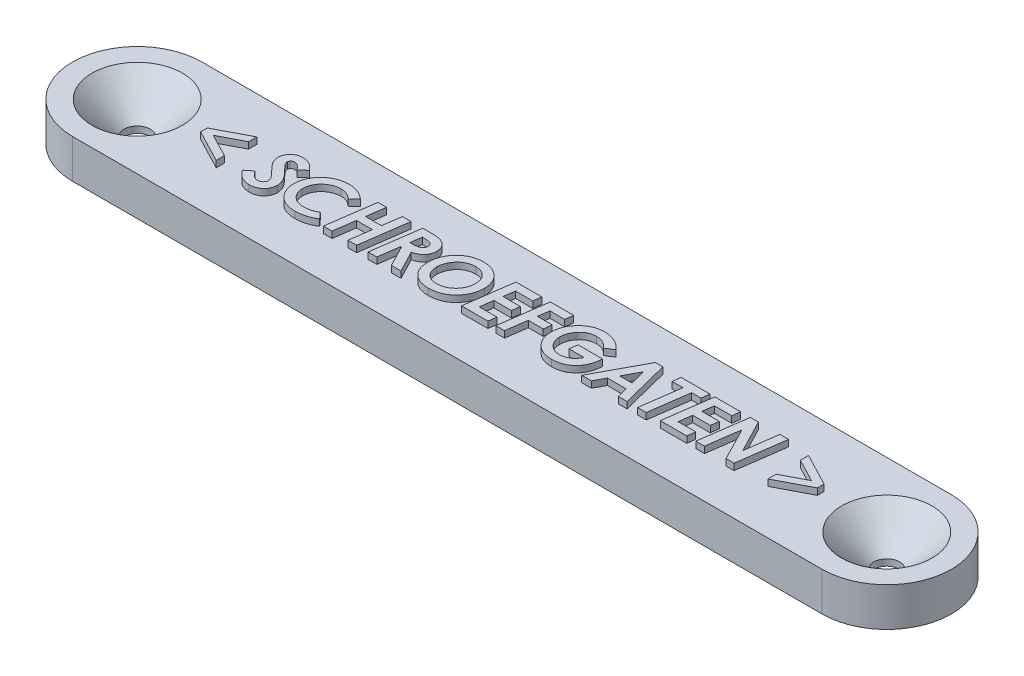
from build123d import *

# Parameters (mm, degrees)
SKETCH1_R           = 1
BOSS_EXTRUDE1_DEPTH = 3
CHAMFER1_SIZE       = 2.5
BOSS_EXTRUDE2_DEPTH = 0.5


with BuildPart() as part:
    # Sketch1 → Boss-Extrude1 (new body)
    with BuildSketch(Plane(origin=(0, 0, 0), x_dir=(1, 0, 0), z_dir=(0, 1, 0))):
        with BuildLine():
            Line((0, 5), (58, 5))
            ThreePointArc((58, 5), (63, 0), (58, -5))
            Line((58, -5), (0, -5))
            ThreePointArc((0, -5), (-5, 0), (0, 5))
        make_face()
        Circle(SKETCH1_R, mode=Mode.SUBTRACT)
        with Locations((58, 0)):
            Circle(SKETCH1_R, mode=Mode.SUBTRACT)
    extrude(amount=BOSS_EXTRUDE1_DEPTH)

    # Chamfer1
    chamfer1_edges = [part.edges().sort_by_distance(p)[0] for p in [
        (57, 3, 0),
        (-1, 3, 0),
    ]]
    chamfer(chamfer1_edges, length=CHAMFER1_SIZE)

    # Sketch2 → Boss-Extrude2 (add)
    # profile 1 of 14: a face of its own
    with BuildSketch(Plane(origin=(0, 3, 0), x_dir=(1, 0, 0), z_dir=(0, 1, 0))):
        Polygon((7.65355235, -0.905865218), (7.65355235, -1.541034822), (5.13661859, -0.230626502), (5.13661859, 0.287303853), (7.65355235, 1.601422276), (7.65355235, 0.96476863), (5.859346621, 0.028338675), align=None)
    # profile 2 of 14: a face of its own
    with BuildSketch(Plane(origin=(0, 3, 0), x_dir=(1, 0, 0), z_dir=(0, 1, 0))):
        with BuildLine():
            Line((11.92536475, 1.389204394), (11.410402477, 0.940281951))
            add(Edge.make_bspline(
                [(11.410402477, 0.940281951), (11.384665885, 0.975048119), (11.335342179, 1.041676839), (11.257075579, 1.131043907), (11.182093303, 1.208702812), (11.106564505, 1.270632453), (11.032945432, 1.319739074), (10.96059455, 1.355310904), (10.88910517, 1.37778951), (10.841418804, 1.380478737), (10.818270065, 1.381784188)],
                knots=[0, 0, 0, 0, 1.358515141, 2.603569235, 3.730126198, 4.746094498, 5.666493297, 6.504166865, 7.273866877, 8, 8, 8, 8], degree=3))
            add(Edge.make_bspline(
                [(10.818270065, 1.381784188), (10.796404105, 1.380837545), (10.754352948, 1.379017024), (10.693991311, 1.363495947), (10.639130466, 1.338529339), (10.592030233, 1.302412061), (10.552692176, 1.260770333), (10.523483135, 1.214040546), (10.506472167, 1.162534021), (10.504114202, 1.126899156), (10.502911325, 1.10872062)],
                knots=[0, 0, 0, 0, 1.130304997, 2.173727141, 3.204821236, 4.229135679, 5.225705988, 6.15679035, 7.05971714, 8, 8, 8, 8], degree=3))
            add(Edge.make_bspline(
                [(10.502911325, 1.10872062), (10.504006811, 1.090812203), (10.50631095, 1.053145396), (10.523192284, 0.996043089), (10.548727533, 0.935877088), (10.57944097, 0.883562673), (10.613925545, 0.836059551), (10.650063219, 0.789578104), (10.697249428, 0.734003819), (10.754667077, 0.668700417), (10.821767628, 0.593116906), (10.90029145, 0.508353037), (10.988824691, 0.413852117), (11.051708052, 0.347853953), (11.084655449, 0.313274573)],
                knots=[0, 0, 0, 0, 0.642317819, 1.35098826, 2.122816345, 2.986294386, 3.520967692, 4.229638134, 5.099348126, 6.137609051, 7.351336444, 8.727500291, 10.285391505, 12, 12, 12, 12], degree=3))
            add(Edge.make_bspline(
                [(11.084655449, 0.313274573), (11.102528567, 0.294785719), (11.136823609, 0.2593092), (11.184944096, 0.207496907), (11.22789262, 0.15947675), (11.267546539, 0.116930566), (11.301492831, 0.07766156), (11.330476559, 0.042611855), (11.355081995, 0.012274649), (11.369628986, -0.006754113), (11.376269531, -0.015440538)],
                knots=[0, 0, 0, 0, 1.403722598, 2.693470914, 3.859630393, 4.920438112, 5.867965235, 6.69256451, 7.40316977, 8, 8, 8, 8], degree=3))
            add(Edge.make_bspline(
                [(11.376269531, -0.015440538), (11.402712591, -0.051971948), (11.453713369, -0.122430146), (11.519865167, -0.229556613), (11.574580087, -0.332770912), (11.617574998, -0.433294573), (11.649738034, -0.532227081), (11.673032762, -0.63120379), (11.68770659, -0.731047986), (11.689334076, -0.798223522), (11.690144231, -0.831663161)],
                knots=[0, 0, 0, 0, 1.215130546, 2.343624586, 3.390252636, 4.360992906, 5.286454858, 6.190345157, 7.099163061, 8, 8, 8, 8], degree=3))
            add(Edge.make_bspline(
                [(11.690144231, -0.831663161), (11.689136088, -0.868571129), (11.687152057, -0.941206196), (11.671778255, -1.047775487), (11.647832372, -1.149958349), (11.612125428, -1.247140884), (11.568036068, -1.340380607), (11.512077301, -1.428312179), (11.447703937, -1.512423398), (11.373388583, -1.59072717), (11.292049236, -1.662335613), (11.203479681, -1.724346137), (11.109861737, -1.777201889), (11.010243727, -1.820716373), (10.904929213, -1.853812707), (10.794106073, -1.877353042), (10.677978887, -1.892979033), (10.59843723, -1.894302718), (10.557820847, -1.894978632)],
                knots=[0, 0, 0, 0, 1.018989505, 2.005376454, 2.968035412, 3.912365187, 4.859556873, 5.811049809, 6.78527381, 7.780773345, 8.787785161, 9.773320145, 10.761314359, 11.752515283, 12.770107012, 13.804505292, 14.878913802, 16, 16, 16, 16], degree=3))
            add(Edge.make_bspline(
                [(10.557820847, -1.894978632), (10.526639512, -1.894353853), (10.464913163, -1.893117044), (10.373423415, -1.884905249), (10.284151966, -1.870886646), (10.197230006, -1.850656762), (10.112476038, -1.825396877), (10.02975793, -1.795076717), (9.949282655, -1.758377698), (9.870947151, -1.716254104), (9.794744177, -1.668541191), (9.721130979, -1.614669838), (9.64931332, -1.555678904), (9.580232499, -1.490451148), (9.512429976, -1.420787083), (9.447093302, -1.345101931), (9.384878995, -1.263078476), (9.345385277, -1.205797993), (9.325324686, -1.176702724)],
                knots=[0, 0, 0, 0, 1.003438088, 1.986398949, 2.953471805, 3.909242729, 4.856156023, 5.798037682, 6.742035895, 7.700024963, 8.658509928, 9.632892881, 10.633707184, 11.647385023, 12.688779161, 13.761077638, 14.862753205, 16, 16, 16, 16], degree=3))
            Line((9.325324686, -1.176702724), (9.873677885, -0.745588775))
            add(Edge.make_bspline(
                [(9.873677885, -0.745588775), (9.900990545, -0.787585501), (9.95337449, -0.868132549), (10.038757904, -0.976856793), (10.125805939, -1.069260272), (10.214834662, -1.14498371), (10.306130499, -1.203902372), (10.399038097, -1.246017905), (10.493970943, -1.27310655), (10.558389263, -1.276117874), (10.590469752, -1.277617521)],
                knots=[0, 0, 0, 0, 1.289844872, 2.473840458, 3.555310637, 4.554525788, 5.477014656, 6.343795492, 7.175205895, 8, 8, 8, 8], degree=3))
            add(Edge.make_bspline(
                [(10.590469752, -1.277617521), (10.620069533, -1.276320302), (10.677691107, -1.273795019), (10.7601185, -1.250282891), (10.835742509, -1.214037424), (10.90121318, -1.162284591), (10.956367633, -1.101504345), (10.996459994, -1.03226263), (11.020596577, -0.956396341), (11.023704547, -0.903814221), (11.025293803, -0.876926416)],
                knots=[0, 0, 0, 0, 1.07813582, 2.098795369, 3.104167493, 4.120866408, 5.124778177, 6.083335831, 7.019916046, 8, 8, 8, 8], degree=3))
            add(Edge.make_bspline(
                [(11.025293803, -0.876926416), (11.024534576, -0.855071999), (11.022990169, -0.810616088), (11.006891192, -0.744403876), (10.982997647, -0.677264993), (10.95403797, -0.62052249), (10.92280308, -0.57076678), (10.889725024, -0.525709461), (10.848103345, -0.472822708), (10.796611476, -0.413347872), (10.737354257, -0.345277082), (10.668086426, -0.27100266), (10.591021126, -0.188066649), (10.535687563, -0.131322189), (10.506621428, -0.101514924)],
                knots=[0, 0, 0, 0, 0.82235112, 1.672813781, 2.554588539, 3.50524042, 4.06657461, 4.767804758, 5.610876414, 6.602916144, 7.732569792, 9.01260869, 10.430754915, 12, 12, 12, 12], degree=3))
            add(Edge.make_bspline(
                [(10.506621428, -0.101514924), (10.47585787, -0.069697232), (10.416386995, -0.008188547), (10.332251633, 0.081829005), (10.256465671, 0.165612464), (10.189114919, 0.243249991), (10.130143746, 0.314881148), (10.078531744, 0.379962524), (10.035841053, 0.439352639), (10.011763768, 0.477886362), (10.000563401, 0.495811632)],
                knots=[0, 0, 0, 0, 1.354401886, 2.618275412, 3.770529779, 4.811580489, 5.763301005, 6.60974666, 7.35327647, 8, 8, 8, 8], degree=3))
            add(Edge.make_bspline(
                [(10.000563401, 0.495811632), (9.975555117, 0.540478683), (9.927034728, 0.627140473), (9.877013805, 0.763538023), (9.844417132, 0.898183223), (9.840155938, 0.98808955), (9.838060897, 1.032292501)],
                knots=[0, 0, 0, 0, 1.081804801, 2.098888081, 3.065307629, 4, 4, 4, 4], degree=3))
            add(Edge.make_bspline(
                [(9.838060897, 1.032292501), (9.838813157, 1.060770824), (9.840309541, 1.117419528), (9.851082355, 1.201025562), (9.867577192, 1.282779467), (9.893872683, 1.36144118), (9.924198968, 1.438980393), (9.963839188, 1.513359684), (10.008375121, 1.586580095), (10.044104925, 1.631938447), (10.062151108, 1.654847756)],
                knots=[0, 0, 0, 0, 1.012167245, 2.013389743, 2.992947912, 3.971795425, 4.958040075, 5.949133471, 6.964161297, 8, 8, 8, 8], degree=3))
            add(Edge.make_bspline(
                [(10.062151108, 1.654847756), (10.085973634, 1.682457888), (10.132960239, 1.736915019), (10.214255986, 1.80652671), (10.300452082, 1.866655373), (10.393403947, 1.914926571), (10.492042712, 1.953399276), (10.597306504, 1.979505584), (10.708388598, 1.996560724), (10.784566047, 1.998271654), (10.823464209, 1.999145299)],
                knots=[0, 0, 0, 0, 1.010152455, 1.992384693, 2.959065588, 3.919519142, 4.890305168, 5.888624478, 6.921877408, 8, 8, 8, 8], degree=3))
            add(Edge.make_bspline(
                [(10.823464209, 1.999145299), (10.877254415, 1.997267403), (10.983363466, 1.993562979), (11.139465627, 1.964770446), (11.288221877, 1.915964641), (11.431119952, 1.849654032), (11.565839644, 1.762326793), (11.694180181, 1.656764256), (11.81607074, 1.532213997), (11.888254643, 1.437762423), (11.92536475, 1.389204394)],
                knots=[0, 0, 0, 0, 0.984438778, 1.941949542, 2.894274057, 3.844399604, 4.817935388, 5.825099055, 6.88187249, 8, 8, 8, 8], degree=3))
        make_face()
    # profile 3 of 14: a face of its own
    with BuildSketch(Plane(origin=(0, 3, 0), x_dir=(1, 0, 0), z_dir=(0, 1, 0))):
        with BuildLine():
            Line((15.829134949, 1.438177751), (15.316398738, 0.978867021))
            add(Edge.make_bspline(
                [(15.316398738, 0.978867021), (15.287944764, 1.010043092), (15.231148684, 1.072272664), (15.132737331, 1.152185225), (15.02611187, 1.221741135), (14.910788409, 1.279487454), (14.788512726, 1.325609251), (14.660334387, 1.35810817), (14.527014325, 1.377949124), (14.436431448, 1.380491185), (14.390357071, 1.381784188)],
                knots=[0, 0, 0, 0, 0.971056601, 1.938295404, 2.910103745, 3.898650509, 4.902833105, 5.914277838, 6.939111328, 8, 8, 8, 8], degree=3))
            add(Edge.make_bspline(
                [(14.390357071, 1.381784188), (14.357684615, 1.381272235), (14.292689091, 1.380253804), (14.195736395, 1.370236986), (14.099884035, 1.353777375), (14.004975928, 1.33150034), (13.910783324, 1.303472759), (13.818335468, 1.267528367), (13.726770855, 1.22572358), (13.636517563, 1.17871277), (13.549784485, 1.1255076), (13.467226333, 1.06835892), (13.389634025, 1.007456469), (13.317402828, 0.941816591), (13.250078502, 0.871893606), (13.186439825, 0.798774187), (13.12966264, 0.720189509), (13.076775516, 0.639051417), (13.030298021, 0.554540509), (12.989679797, 0.468467289), (12.953817287, 0.381445857), (12.92736246, 0.292117511), (12.9041292, 0.201998772), (12.889232883, 0.110089943), (12.878827837, 0.016953038), (12.877862472, -0.045586599), (12.877377137, -0.077028245)],
                knots=[0, 0, 0, 0, 1.01063672, 2.010466049, 3.011934156, 4.018040672, 5.025194429, 6.049901815, 7.084166442, 8.138480354, 9.196343408, 10.230183256, 11.243713301, 12.245999792, 13.247233952, 14.245803109, 15.242258641, 16.244194478, 17.240973215, 18.223430354, 19.188354289, 20.149355445, 21.103383867, 22.065846529, 23.027609163, 24, 24, 24, 24], degree=3))
            add(Edge.make_bspline(
                [(12.877377137, -0.077028245), (12.878195301, -0.119143153), (12.879805042, -0.202004316), (12.897870387, -0.323398575), (12.924758704, -0.439639253), (12.963675838, -0.550339178), (13.013865938, -0.655255128), (13.073831292, -0.75562748), (13.146797276, -0.849043884), (13.228524504, -0.937228238), (13.319478886, -1.016745395), (13.416952536, -1.087336773), (13.52156616, -1.145813144), (13.631928549, -1.19468018), (13.749029565, -1.231483151), (13.871966327, -1.258048366), (14.001065774, -1.275016288), (14.089290034, -1.276737983), (14.134359976, -1.277617521)],
                knots=[0, 0, 0, 0, 1.037508871, 2.041300697, 3.018951676, 3.975513831, 4.927438979, 5.88223082, 6.851861871, 7.844178858, 8.842305637, 9.825493826, 10.805727671, 11.791408773, 12.796144752, 13.825955475, 14.88937509, 16, 16, 16, 16], degree=3))
            add(Edge.make_bspline(
                [(14.134359976, -1.277617521), (14.182869805, -1.276789753), (14.27834663, -1.275160543), (14.418919719, -1.261480807), (14.554534235, -1.239271468), (14.685092768, -1.208388655), (14.810725676, -1.167808836), (14.931464251, -1.119179358), (15.047451826, -1.061177656), (15.120354868, -1.015537811), (15.156864316, -0.992681624)],
                knots=[0, 0, 0, 0, 1.080949117, 2.127519159, 3.144326023, 4.141762213, 5.114520833, 6.083915527, 7.040435296, 8, 8, 8, 8], degree=3))
            Line((15.156864316, -0.992681624), (15.573137854, -1.451250334))
            add(Edge.make_bspline(
                [(15.573137854, -1.451250334), (15.520005097, -1.486751513), (15.414030786, -1.5575593), (15.24589681, -1.64786699), (15.071458093, -1.723673512), (14.89135233, -1.786120454), (14.705154197, -1.835482035), (14.512590028, -1.869975418), (14.313677669, -1.891455454), (14.178936344, -1.893793247), (14.110615318, -1.894978632)],
                knots=[0, 0, 0, 0, 0.987115275, 1.968820479, 2.944554184, 3.923725951, 4.912076401, 5.918257257, 6.944445583, 8, 8, 8, 8], degree=3))
            add(Edge.make_bspline(
                [(14.110615318, -1.894978632), (14.062858571, -1.89424045), (13.968962477, -1.892789087), (13.831013186, -1.882136586), (13.698383294, -1.865468257), (13.571328102, -1.840777042), (13.449599601, -1.809796701), (13.333169069, -1.772032059), (13.222496854, -1.726502309), (13.116916125, -1.674799115), (13.016990188, -1.615582138), (12.92180101, -1.550431893), (12.832060739, -1.478177643), (12.747014389, -1.400100513), (12.667447816, -1.315238283), (12.593158129, -1.223497509), (12.523489431, -1.125628734), (12.459120856, -1.02214146), (12.401325007, -0.914077443), (12.351243605, -0.802859415), (12.30737676, -0.690001037), (12.273816785, -0.574050863), (12.245882088, -0.456542615), (12.226926139, -0.336224642), (12.214442034, -0.214073249), (12.213166812, -0.131721447), (12.212526709, -0.090384615)],
                knots=[0, 0, 0, 0, 1.169367826, 2.299132101, 3.38621766, 4.441052208, 5.466435492, 6.460518735, 7.435693363, 8.394593391, 9.33676259, 10.277587488, 11.216890426, 12.155626877, 13.10261201, 14.062754619, 15.044266364, 16.042621295, 17.045211417, 18.042739217, 19.028130471, 20.007415779, 20.996189116, 21.983978755, 22.988049715, 24, 24, 24, 24], degree=3))
            add(Edge.make_bspline(
                [(12.212526709, -0.090384615), (12.213304775, -0.045823003), (12.214856203, 0.043030823), (12.229818041, 0.17562325), (12.252452335, 0.306819915), (12.284854114, 0.436615045), (12.325218912, 0.565057447), (12.376503636, 0.691601182), (12.435575802, 0.817319298), (12.504708489, 0.94032363), (12.580156068, 1.06008643), (12.663895405, 1.173319652), (12.753878353, 1.280113295), (12.849304433, 1.381472327), (12.952250724, 1.475147426), (13.061767571, 1.562115474), (13.177449764, 1.642979921), (13.299117426, 1.717087968), (13.425067516, 1.783702915), (13.554983099, 1.840810679), (13.687358344, 1.890224791), (13.822727919, 1.930191825), (13.961169709, 1.960581695), (14.102120175, 1.982885246), (14.246132819, 1.996601689), (14.343085483, 1.998294179), (14.391841112, 1.999145299)],
                knots=[0, 0, 0, 0, 0.95794203, 1.910092795, 2.865876462, 3.819215003, 4.78477586, 5.758651491, 6.753180615, 7.769892659, 8.790977917, 9.795230985, 10.79565955, 11.792688852, 12.786634645, 13.785945562, 14.798181656, 15.819862441, 16.847685968, 17.859754353, 18.869513914, 19.884373831, 20.892254455, 21.915374149, 22.951681752, 24, 24, 24, 24], degree=3))
            add(Edge.make_bspline(
                [(14.391841112, 1.999145299), (14.459941593, 1.99741256), (14.59441842, 1.993990949), (14.792468982, 1.967479879), (14.98360689, 1.923781582), (15.16757276, 1.861658078), (15.345042714, 1.783005084), (15.514840349, 1.685771317), (15.677681934, 1.571261831), (15.778218604, 1.482918722), (15.829134949, 1.438177751)],
                knots=[0, 0, 0, 0, 1.033545388, 2.040923972, 3.027343848, 4.005734438, 4.983995331, 5.969464303, 6.971644303, 8, 8, 8, 8], degree=3))
        make_face()
    # profile 4 of 14: a face of its own
    with BuildSketch(Plane(origin=(0, 3, 0), x_dir=(1, 0, 0), z_dir=(0, 1, 0))):
        Polygon((16.72104367, 1.904166667), (17.391830262, 1.904166667), (17.192226729, 0.479487179), (18.421754808, 0.479487179), (18.620616319, 1.904166667), (19.291402911, 1.904166667), (18.771988515, -1.8), (18.101201923, -1.8), (18.334196381, -0.137873932), (17.105410323, -0.137873932), (16.872415865, -1.8), (16.201629274, -1.8), align=None)
    # profile 5 of 14: a face of its own
    with BuildSketch(Plane(origin=(0, 3, 0), x_dir=(1, 0, 0), z_dir=(0, 1, 0))):
        with BuildLine():
            Line((20.187763755, 1.904166667), (20.831095586, 1.904166667))
            add(Edge.make_bspline(
                [(20.831095586, 1.904166667), (20.878837763, 1.903971565), (20.970890419, 1.903595386), (21.103265133, 1.898246117), (21.2247626, 1.89017572), (21.335238355, 1.879525232), (21.434784634, 1.864748276), (21.523194423, 1.84700558), (21.601032417, 1.827246616), (21.647711587, 1.808885297), (21.669578826, 1.800283787)],
                knots=[0, 0, 0, 0, 1.348808202, 2.600664361, 3.742342956, 4.788858012, 5.735658768, 6.584006912, 7.336666444, 8, 8, 8, 8], degree=3))
            add(Edge.make_bspline(
                [(21.669578826, 1.800283787), (21.694198526, 1.789181479), (21.742326142, 1.767478223), (21.811290211, 1.730689872), (21.875869694, 1.691058834), (21.934994302, 1.647090889), (21.989911746, 1.600637385), (22.04028149, 1.551256489), (22.085697951, 1.498190355), (22.126637766, 1.442390796), (22.163041272, 1.38392998), (22.194289932, 1.32251962), (22.221310107, 1.258679634), (22.242410624, 1.19171533), (22.25994769, 1.122430539), (22.271290028, 1.050388121), (22.27927223, 0.975831089), (22.279928123, 0.925216609), (22.280261752, 0.89947082)],
                knots=[0, 0, 0, 0, 1.116361014, 2.182309107, 3.229450697, 4.24598407, 5.225421932, 6.201651319, 7.158895679, 8.110002388, 9.060669178, 10.002827475, 10.956240434, 11.923213192, 12.902917952, 13.908279153, 14.936015885, 16, 16, 16, 16], degree=3))
            add(Edge.make_bspline(
                [(22.280261752, 0.89947082), (22.27947714, 0.867788855), (22.277928188, 0.805243527), (22.267807013, 0.713012028), (22.248929763, 0.624506329), (22.223507801, 0.539447629), (22.192012031, 0.457285183), (22.151394115, 0.379448679), (22.104444856, 0.304581912), (22.050223252, 0.233666431), (21.989617555, 0.166051704), (21.919639209, 0.105716933), (21.844159514, 0.048604433), (21.76007766, -0.001456654), (21.669706103, -0.047958946), (21.570983598, -0.087358515), (21.46576301, -0.123718235), (21.391984253, -0.141915768), (21.354220085, -0.151230302)],
                knots=[0, 0, 0, 0, 0.995453645, 1.965186658, 2.910129054, 3.83459069, 4.752398018, 5.669942118, 6.588407184, 7.525617038, 8.471772905, 9.435289717, 10.423772802, 11.441988612, 12.505459691, 13.613754905, 14.778583949, 16, 16, 16, 16], degree=3))
            Line((21.354220085, -0.151230302), (22.209027778, -1.8))
            Line((22.209027778, -1.8), (21.466265191, -1.8))
            Line((21.466265191, -1.8), (20.629265992, -0.185363248))
            Line((20.629265992, -0.185363248), (20.566194244, -0.185363248))
            Line((20.566194244, -0.185363248), (20.339135951, -1.8))
            Line((20.339135951, -1.8), (19.668349359, -1.8))
            Line((19.668349359, -1.8), (20.187763755, 1.904166667))
        make_face()
        with BuildLine():
            add(Edge.make_bspline(
                [(20.65301065, 0.431997863), (20.700754262, 0.432441188), (20.79207578, 0.433289158), (20.922500959, 0.4391874), (21.040114383, 0.44850448), (21.144576852, 0.461819195), (21.236163158, 0.477565686), (21.314484241, 0.497224054), (21.379899086, 0.520597497), (21.433439454, 0.548316066), (21.476810839, 0.580860369), (21.514350636, 0.615590242), (21.545609271, 0.65446649), (21.571400446, 0.696836462), (21.59129233, 0.742787979), (21.605637453, 0.792632354), (21.613568986, 0.846037247), (21.614788289, 0.882874105), (21.615411325, 0.901696882)],
                knots=[0, 0, 0, 0, 1.892208387, 3.619318591, 5.173427176, 6.566868293, 7.791773198, 8.8545744, 9.763297566, 10.539470204, 11.233547833, 11.906251103, 12.5615143, 13.203742025, 13.866659999, 14.539934446, 15.25394049, 16, 16, 16, 16], degree=3))
            add(Edge.make_bspline(
                [(21.615411325, 0.901696882), (21.614604829, 0.923039193), (21.613040339, 0.96444035), (21.599508136, 1.024069956), (21.576368534, 1.078162107), (21.543848978, 1.126199659), (21.50326632, 1.168556794), (21.453757701, 1.203442781), (21.395888841, 1.230904765), (21.341679523, 1.249048065), (21.290367562, 1.259557129), (21.242534927, 1.266617813), (21.185902424, 1.273431121), (21.120299704, 1.278469347), (21.045805631, 1.28180204), (20.962458132, 1.285040468), (20.870425351, 1.286192071), (20.806114061, 1.286594871), (20.772475962, 1.286805556)],
                knots=[0, 0, 0, 0, 0.974340854, 1.890087692, 2.776057671, 3.647490651, 4.526730822, 5.442477659, 6.397820337, 7.445016909, 8.045730266, 8.789007992, 9.653967296, 10.651691253, 11.794598421, 13.061237498, 14.462876682, 16, 16, 16, 16], degree=3))
            Line((20.772475962, 1.286805556), (20.65301065, 0.431997863))
        make_face(mode=Mode.SUBTRACT)
    # profile 6 of 14: a face of its own
    with BuildSketch(Plane(origin=(0, 3, 0), x_dir=(1, 0, 0), z_dir=(0, 1, 0))):
        with BuildLine():
            add(Edge.make_bspline(
                [(24.840974726, 1.999145299), (24.903379166, 1.99783561), (25.025908427, 1.995264074), (25.20551016, 1.971599716), (25.376853801, 1.933457662), (25.539521877, 1.878762863), (25.694138955, 1.809665616), (25.840332983, 1.724512075), (25.977944328, 1.623903248), (26.105852513, 1.509202352), (26.221712978, 1.38282257), (26.324456828, 1.247556763), (26.409784483, 1.102789662), (26.480054145, 0.950133294), (26.535447351, 0.789420741), (26.573233484, 0.619879694), (26.598175332, 0.442633545), (26.60057002, 0.321524598), (26.60178953, 0.259849092)],
                knots=[0, 0, 0, 0, 1.079937363, 2.120424901, 3.130164457, 4.114608815, 5.086352068, 6.057283592, 7.037967613, 8.032612779, 9.026667848, 10.002130715, 10.967845321, 11.92966918, 12.907375778, 13.904589319, 14.932898699, 16, 16, 16, 16], degree=3))
            add(Edge.make_bspline(
                [(26.60178953, 0.259849092), (26.601008513, 0.211829104), (26.599455131, 0.11632107), (26.584673966, -0.025689715), (26.56164691, -0.165685149), (26.530117391, -0.303705639), (26.487911999, -0.439308508), (26.437532265, -0.57329719), (26.377431133, -0.705123482), (26.30840822, -0.833766312), (26.2327952, -0.957710373), (26.149918704, -1.074908673), (26.060884103, -1.184665661), (25.966033103, -1.287413441), (25.864341502, -1.381776489), (25.757796905, -1.469731634), (25.644091212, -1.549279635), (25.525029499, -1.621940183), (25.40036293, -1.686516046), (25.270933905, -1.742329491), (25.136910876, -1.78899463), (24.998610297, -1.827574508), (24.855690573, -1.858267091), (24.708178165, -1.879469526), (24.556021328, -1.892337061), (24.4531707, -1.89408915), (24.40095653, -1.894978632)],
                knots=[0, 0, 0, 0, 1.005311864, 1.999487392, 2.986390894, 3.975195422, 4.961487101, 5.958115224, 6.97104375, 7.992937587, 9.013623077, 10.009524137, 10.996414046, 11.971324635, 12.935123389, 13.899409138, 14.862205298, 15.838449601, 16.81836937, 17.799766407, 18.787539403, 19.787875373, 20.804768927, 21.846385261, 22.906674593, 24, 24, 24, 24], degree=3))
            add(Edge.make_bspline(
                [(24.40095653, -1.894978632), (24.336329903, -1.893646804), (24.21013892, -1.891046255), (24.026224195, -1.8680783), (23.852213744, -1.8322174), (23.688099547, -1.78087983), (23.533575873, -1.714680877), (23.389152656, -1.633452202), (23.254476271, -1.538079436), (23.131804394, -1.427886564), (23.020258143, -1.307015322), (22.924472343, -1.174460661), (22.841755658, -1.033801189), (22.776131761, -0.882732112), (22.723621006, -0.723107257), (22.68703601, -0.554008383), (22.664157263, -0.375701577), (22.661523437, -0.253700669), (22.660176282, -0.191299412)],
                knots=[0, 0, 0, 0, 1.129126937, 2.20475128, 3.23403939, 4.230775744, 5.204839333, 6.16680792, 7.121629951, 8.083044708, 9.04383724, 9.990659777, 10.936010704, 11.890255174, 12.863608629, 13.868449271, 14.909750384, 16, 16, 16, 16], degree=3))
            add(Edge.make_bspline(
                [(22.660176282, -0.191299412), (22.661794793, -0.119971845), (22.664981727, 0.020475947), (22.692996639, 0.22721353), (22.735818185, 0.426771216), (22.798913702, 0.618088672), (22.878485915, 0.801891871), (22.976493285, 0.977568843), (23.091417239, 1.14654413), (23.181015195, 1.250529441), (23.226337974, 1.303130008)],
                knots=[0, 0, 0, 0, 1.045740506, 2.05911896, 3.05467723, 4.035585325, 5.008815224, 5.988058098, 6.982266978, 8, 8, 8, 8], degree=3))
            add(Edge.make_bspline(
                [(23.226337974, 1.303130008), (23.252721762, 1.331649666), (23.305014305, 1.388175493), (23.388705276, 1.466728325), (23.474444941, 1.540272881), (23.563446927, 1.607936093), (23.654367042, 1.671289494), (23.748654098, 1.728336338), (23.845951431, 1.779695653), (23.945200838, 1.826528663), (24.048110022, 1.866516912), (24.152900143, 1.902346406), (24.261025441, 1.931909085), (24.371723863, 1.956377507), (24.485101376, 1.975833117), (24.601308614, 1.988890291), (24.720147879, 1.997340056), (24.800396423, 1.998539029), (24.840974726, 1.999145299)],
                knots=[0, 0, 0, 0, 1.027812829, 2.037120149, 3.035266778, 4.015768311, 4.994345575, 5.966422343, 6.929711672, 7.904780536, 8.86860337, 9.849672715, 10.834163809, 11.833018336, 12.848777673, 13.876590502, 14.926281379, 16, 16, 16, 16], degree=3))
        make_face()
        with BuildLine():
            add(Edge.make_bspline(
                [(24.825392294, 1.381784188), (24.791729873, 1.381280941), (24.724758752, 1.380279735), (24.625633644, 1.370211134), (24.528502689, 1.354610689), (24.433773998, 1.333231179), (24.340993089, 1.305638605), (24.250791644, 1.271539428), (24.162503219, 1.231184378), (24.077101183, 1.184618919), (23.994299043, 1.132691958), (23.915825828, 1.074740632), (23.841129727, 1.011594535), (23.771468006, 0.942140359), (23.705310936, 0.867805204), (23.642843712, 0.788438926), (23.584846527, 0.703268528), (23.531061422, 0.613710727), (23.483317384, 0.520500018), (23.440910061, 0.426504143), (23.404818679, 0.331709721), (23.376196072, 0.23585901), (23.352830489, 0.139336256), (23.336628602, 0.041887148), (23.326568854, -0.056284237), (23.325541301, -0.122020252), (23.325026709, -0.154940405)],
                knots=[0, 0, 0, 0, 1.015557909, 2.02044445, 3.003357477, 3.982977463, 4.948851735, 5.922052592, 6.890662853, 7.875953625, 8.855459861, 9.837777552, 10.817397539, 11.804383193, 12.803598646, 13.818964529, 14.849984807, 15.911175445, 16.969421976, 18.008462528, 19.021851172, 20.027762868, 21.025304218, 22.016795393, 23.006824523, 24, 24, 24, 24], degree=3))
            add(Edge.make_bspline(
                [(23.325026709, -0.154940405), (23.325839108, -0.193321537), (23.327437548, -0.268838516), (23.34136608, -0.380004132), (23.362946986, -0.487029897), (23.395603582, -0.589028789), (23.435284257, -0.687103641), (23.485665132, -0.779788652), (23.543580511, -0.868916506), (23.610892623, -0.952223241), (23.68607647, -1.029137701), (23.770896879, -1.095494991), (23.863195624, -1.152156063), (23.963369116, -1.198263138), (24.071334818, -1.234249613), (24.187370368, -1.258703179), (24.310965181, -1.274907551), (24.395955606, -1.276698871), (24.4395416, -1.277617521)],
                knots=[0, 0, 0, 0, 1.032572517, 2.031642993, 3.01079972, 3.966643664, 4.909863955, 5.853952978, 6.801111379, 7.766917104, 8.731873648, 9.689385086, 10.65752794, 11.640388645, 12.650815691, 13.713650281, 14.827481725, 16, 16, 16, 16], degree=3))
            add(Edge.make_bspline(
                [(24.4395416, -1.277617521), (24.490562849, -1.276412032), (24.591309674, -1.274031665), (24.739289095, -1.252830476), (24.881342587, -1.217635669), (25.017482345, -1.169541523), (25.147752225, -1.107293177), (25.272155458, -1.031320364), (25.390371056, -0.940898348), (25.501448058, -0.838392269), (25.603485575, -0.726509743), (25.692680126, -0.606936912), (25.76842763, -0.481248038), (25.830141444, -0.349717967), (25.877891534, -0.212125307), (25.911930858, -0.068711802), (25.933411675, 0.080618893), (25.935753319, 0.182358515), (25.936939103, 0.233878372)],
                knots=[0, 0, 0, 0, 1.03369803, 2.041145535, 3.022357397, 3.995919545, 4.96236968, 5.943376615, 6.945032455, 7.973917545, 9.003120129, 10.009769043, 10.992465341, 11.972511115, 12.949140339, 13.93890809, 14.956285095, 16, 16, 16, 16], degree=3))
            add(Edge.make_bspline(
                [(25.936939103, 0.233878372), (25.936255026, 0.276222576), (25.934914389, 0.359207661), (25.919434939, 0.480047349), (25.895921111, 0.594582544), (25.862866903, 0.702777846), (25.818345415, 0.804024562), (25.766113969, 0.899569026), (25.70285767, 0.987790299), (25.631174351, 1.068980063), (25.551922417, 1.142752703), (25.465477546, 1.206360078), (25.373719472, 1.261586488), (25.27507886, 1.304671611), (25.171340599, 1.340407979), (25.061281952, 1.364433737), (24.945230649, 1.378622147), (24.865997159, 1.380712793), (24.825392294, 1.381784188)],
                knots=[0, 0, 0, 0, 1.12845219, 2.211511647, 3.242392028, 4.243671568, 5.221368115, 6.186708094, 7.141970352, 8.109200861, 9.070590294, 10.022934043, 10.966237583, 11.91979086, 12.887493425, 13.887534174, 14.917422563, 16, 16, 16, 16], degree=3))
        make_face(mode=Mode.SUBTRACT)
    # profile 7 of 14: a face of its own
    with BuildSketch(Plane(origin=(0, 3, 0), x_dir=(1, 0, 0), z_dir=(0, 1, 0))):
        Polygon((27.406139824, 1.904166667), (29.403659188, 1.904166667), (29.325747029, 1.286805556), (27.99085203, 1.286805556), (27.870644698, 0.431997863), (29.218154046, 0.431997863), (29.139499866, -0.185363248), (27.783828292, -0.185363248), (27.644328425, -1.182638889), (29.014098391, -1.182638889), (28.936186231, -1.8), (26.886725427, -1.8), align=None)
    # profile 8 of 14: a face of its own
    with BuildSketch(Plane(origin=(0, 3, 0), x_dir=(1, 0, 0), z_dir=(0, 1, 0))):
        Polygon((30.065541533, 1.904166667), (31.873103632, 1.904166667), (31.792223391, 1.286805556), (30.650253739, 1.286805556), (30.530046408, 0.431997863), (31.680920306, 0.431997863), (31.600040064, -0.185363248), (30.443972022, -0.185363248), (30.216913729, -1.8), (29.546127137, -1.8), align=None)
    # profile 9 of 14: a face of its own
    with BuildSketch(Plane(origin=(0, 3, 0), x_dir=(1, 0, 0), z_dir=(0, 1, 0))):
        with BuildLine():
            Line((35.799876469, 1.228927951), (35.209970119, 0.859401709))
            add(Edge.make_bspline(
                [(35.209970119, 0.859401709), (35.168131131, 0.905104079), (35.088203451, 0.992412223), (34.962836556, 1.106566246), (34.839340063, 1.198498569), (34.715801169, 1.268485424), (34.58940839, 1.320459141), (34.456630792, 1.355426873), (34.316086252, 1.377663909), (34.219706278, 1.380389701), (34.170399306, 1.381784188)],
                knots=[0, 0, 0, 0, 1.232977487, 2.355435308, 3.369770187, 4.291348691, 5.174604885, 6.082334442, 7.018942652, 8, 8, 8, 8], degree=3))
            add(Edge.make_bspline(
                [(34.170399306, 1.381784188), (34.116862232, 1.380365132), (34.011642857, 1.377576181), (33.85818019, 1.351184454), (33.71195929, 1.310820374), (33.573605805, 1.25235551), (33.443036135, 1.176704507), (33.320093616, 1.084806845), (33.204692285, 0.976573388), (33.136629326, 0.8940843), (33.10188969, 0.851981504)],
                knots=[0, 0, 0, 0, 1.037106879, 2.038283569, 3.009830787, 3.972569298, 4.94146214, 5.928319872, 6.942605276, 8, 8, 8, 8], degree=3))
            add(Edge.make_bspline(
                [(33.10188969, 0.851981504), (33.075792969, 0.816786349), (33.024240137, 0.747259996), (32.958434987, 0.636612597), (32.901730577, 0.523937421), (32.855245975, 0.408106898), (32.81967801, 0.289347903), (32.794557485, 0.167426399), (32.778319518, 0.042874623), (32.776377091, -0.041361338), (32.775400641, -0.08370643)],
                knots=[0, 0, 0, 0, 1.040960542, 2.056368018, 3.055559505, 4.03710588, 5.019268411, 5.998275661, 6.99374091, 8, 8, 8, 8], degree=3))
            add(Edge.make_bspline(
                [(32.775400641, -0.08370643), (32.776399824, -0.125055001), (32.778369597, -0.206568965), (32.793887811, -0.326229192), (32.821233703, -0.440504404), (32.857090882, -0.55026279), (32.905108361, -0.654509589), (32.963229065, -0.753713907), (33.031929127, -0.847607012), (33.110352728, -0.935406326), (33.196161813, -1.015567521), (33.287774598, -1.085827883), (33.384297425, -1.144966756), (33.485768999, -1.193393212), (33.592126163, -1.231509313), (33.703629695, -1.257942756), (33.819640219, -1.274951304), (33.898759238, -1.276720284), (33.938888889, -1.277617521)],
                knots=[0, 0, 0, 0, 1.066897471, 2.103265977, 3.106535126, 4.095591644, 5.078159493, 6.062322472, 7.058152725, 8.075375883, 9.096057735, 10.084186963, 11.049730852, 12.011871914, 12.980953841, 13.959387168, 14.96498868, 16, 16, 16, 16], degree=3))
            add(Edge.make_bspline(
                [(33.938888889, -1.277617521), (33.969086261, -1.277058041), (34.028871929, -1.275950366), (34.117395415, -1.266785923), (34.203909936, -1.251900581), (34.288300438, -1.231330243), (34.370557992, -1.204282908), (34.450856035, -1.171497715), (34.529415996, -1.133189655), (34.605362645, -1.088230435), (34.67881765, -1.038065884), (34.748742579, -0.981440507), (34.814980696, -0.918705269), (34.878062985, -0.850190571), (34.938401469, -0.776261732), (34.993844365, -0.695374195), (35.046867538, -0.609312905), (35.078737657, -0.548657224), (35.094956931, -0.517788462)],
                knots=[0, 0, 0, 0, 0.990751711, 1.961520103, 2.916931976, 3.869720035, 4.809138875, 5.755683625, 6.713987145, 7.674487982, 8.649319602, 9.630449541, 10.623757948, 11.640402946, 12.684918653, 13.752145235, 14.856026455, 16, 16, 16, 16], degree=3))
            Line((35.094956931, -0.517788462), (33.925532519, -0.517788462))
            Line((33.925532519, -0.517788462), (34.010122863, 0.09957265))
            Line((34.010122863, 0.09957265), (35.909695513, 0.09957265))
            add(Edge.make_bspline(
                [(35.909695513, 0.09957265), (35.904944037, 0.025007734), (35.895652329, -0.120807039), (35.862026397, -0.333130712), (35.81222505, -0.533367041), (35.747670944, -0.722287526), (35.667712337, -0.8995398), (35.571106555, -1.064643428), (35.459746468, -1.218219165), (35.33262045, -1.358253749), (35.193416949, -1.483904861), (35.044738422, -1.594914174), (34.885455988, -1.686994607), (34.717692959, -1.763058582), (34.54078906, -1.822883835), (34.354294519, -1.864825268), (34.158514362, -1.890677751), (34.024797082, -1.893527373), (33.956697382, -1.894978632)],
                knots=[0, 0, 0, 0, 1.148955532, 2.246830018, 3.301660101, 4.319666133, 5.314146826, 6.287838685, 7.257462643, 8.227280698, 9.191724348, 10.138440807, 11.076252923, 12.016254752, 12.968042649, 13.943717582, 14.952773983, 16, 16, 16, 16], degree=3))
            add(Edge.make_bspline(
                [(33.956697382, -1.894978632), (33.919337455, -1.894608172), (33.845530401, -1.893876304), (33.736546486, -1.886357932), (33.630624893, -1.873522001), (33.527832184, -1.856661826), (33.427715159, -1.835112075), (33.330788558, -1.808574641), (33.236827468, -1.77667536), (33.146419764, -1.738880635), (33.057640348, -1.699003219), (32.973244737, -1.651498049), (32.891158057, -1.600507402), (32.812670974, -1.543827585), (32.736600383, -1.482965023), (32.664098636, -1.416945978), (32.594531331, -1.346031985), (32.551043292, -1.29566814), (32.529049813, -1.270197316)],
                knots=[0, 0, 0, 0, 1.111499042, 2.195841241, 3.24834816, 4.285223882, 5.294222847, 6.294054786, 7.273859608, 8.244193736, 9.208986092, 10.167555097, 11.123181443, 12.083077344, 13.046240314, 14.020501641, 14.998895854, 16, 16, 16, 16], degree=3))
            add(Edge.make_bspline(
                [(32.529049813, -1.270197316), (32.495618423, -1.227975732), (32.429241731, -1.144146459), (32.344031654, -1.009073717), (32.271315288, -0.868206795), (32.213083028, -0.720825971), (32.166528921, -0.568068712), (32.134031125, -0.409095543), (32.114479733, -0.244226974), (32.111870925, -0.132238477), (32.110550214, -0.075544204)],
                knots=[0, 0, 0, 0, 0.999328569, 1.984127054, 2.959716786, 3.938705326, 4.922250225, 5.921072174, 6.947541011, 8, 8, 8, 8], degree=3))
            add(Edge.make_bspline(
                [(32.110550214, -0.075544204), (32.112324227, -0.006179427), (32.11582479, 0.130694267), (32.146008232, 0.331930682), (32.192957188, 0.526387097), (32.261269843, 0.713089715), (32.347504372, 0.893098075), (32.454035568, 1.065031002), (32.57828312, 1.230801297), (32.721331996, 1.385896089), (32.876462133, 1.529233779), (33.041186028, 1.655141514), (33.213915047, 1.761121568), (33.393239932, 1.848885594), (33.580872417, 1.915615896), (33.775163335, 1.963911041), (33.977040728, 1.993838363), (34.114149734, 1.997358325), (34.183755676, 1.999145299)],
                knots=[0, 0, 0, 0, 1.022519879, 2.01768214, 2.99445506, 3.968403767, 4.944092992, 5.933246428, 6.946641619, 7.994936793, 9.040543676, 10.058341478, 11.047494914, 12.024771785, 12.997483176, 13.978673844, 14.973836105, 16, 16, 16, 16], degree=3))
            add(Edge.make_bspline(
                [(34.183755676, 1.999145299), (34.235997503, 1.99829867), (34.340023784, 1.996612823), (34.494654374, 1.978352238), (34.647603882, 1.951516396), (34.797390854, 1.911777365), (34.943031349, 1.863311479), (35.082547318, 1.805291904), (35.214592799, 1.737902835), (35.340146148, 1.660471196), (35.460454045, 1.572108237), (35.577790639, 1.471172576), (35.691788621, 1.356206209), (35.763328205, 1.27196516), (35.799876469, 1.228927951)],
                knots=[0, 0, 0, 0, 1.014010841, 2.019144067, 3.019687909, 4.027399918, 5.025300219, 5.998481464, 6.958680332, 7.901091373, 8.859847597, 9.854378501, 10.903841272, 12, 12, 12, 12], degree=3))
        make_face()
    # profile 10 of 14: a face of its own
    with BuildSketch(Plane(origin=(0, 3, 0), x_dir=(1, 0, 0), z_dir=(0, 1, 0))):
        Polygon((38.185472589, 1.904166667), (38.768700755, 1.904166667), (39.708840812, -1.8), (39.02469785, -1.8), (38.819900174, -0.992681624), (37.375928152, -0.992681624), (36.942588141, -1.8), (36.19463141, -1.8), align=None)
        Polygon((38.661849793, -0.375320513), (38.35613732, 0.830462907), (37.708353365, -0.375320513), align=None, mode=Mode.SUBTRACT)
    # profile 11 of 14: a face of its own
    with BuildSketch(Plane(origin=(0, 3, 0), x_dir=(1, 0, 0), z_dir=(0, 1, 0))):
        Polygon((40.183733974, 1.904166667), (42.415731838, 1.904166667), (42.335593616, 1.286805556), (41.614349626, 1.286805556), (41.186203759, -1.8), (40.516159188, -1.8), (40.943563034, 1.286805556), (40.098401609, 1.286805556), align=None)
    # profile 12 of 14: a face of its own
    with BuildSketch(Plane(origin=(0, 3, 0), x_dir=(1, 0, 0), z_dir=(0, 1, 0))):
        Polygon((42.792678285, 1.904166667), (44.79019765, 1.904166667), (44.71228549, 1.286805556), (43.377390491, 1.286805556), (43.25718316, 0.431997863), (44.604692508, 0.431997863), (44.526038328, -0.185363248), (43.170366753, -0.185363248), (43.030866887, -1.182638889), (44.400636852, -1.182638889), (44.322724693, -1.8), (42.273263889, -1.8), align=None)
    # profile 13 of 14: a face of its own
    with BuildSketch(Plane(origin=(0, 3, 0), x_dir=(1, 0, 0), z_dir=(0, 1, 0))):
        Polygon((45.542606504, 1.904166667), (46.1666458, 1.904166667), (47.473344017, -0.614251135), (47.826545807, 1.904166667), (48.497332399, 1.904166667), (47.978660023, -1.8), (47.35981487, -1.8), (46.04866453, 0.745872563), (45.692494658, -1.8), (45.021708066, -1.8), align=None)
    # profile 14 of 14: a face of its own
    with BuildSketch(Plane(origin=(0, 3, 0), x_dir=(1, 0, 0), z_dir=(0, 1, 0))):
        Polygon((50.34644765, 0.96476863), (50.34644765, 1.600680255), (52.86338141, 0.288787894), (52.86338141, -0.232110544), (50.34644765, -1.541034822), (50.34644765, -0.905865218), (52.14287944, 0.028338675), align=None)
    extrude(amount=BOSS_EXTRUDE2_DEPTH)


solid = part.part
